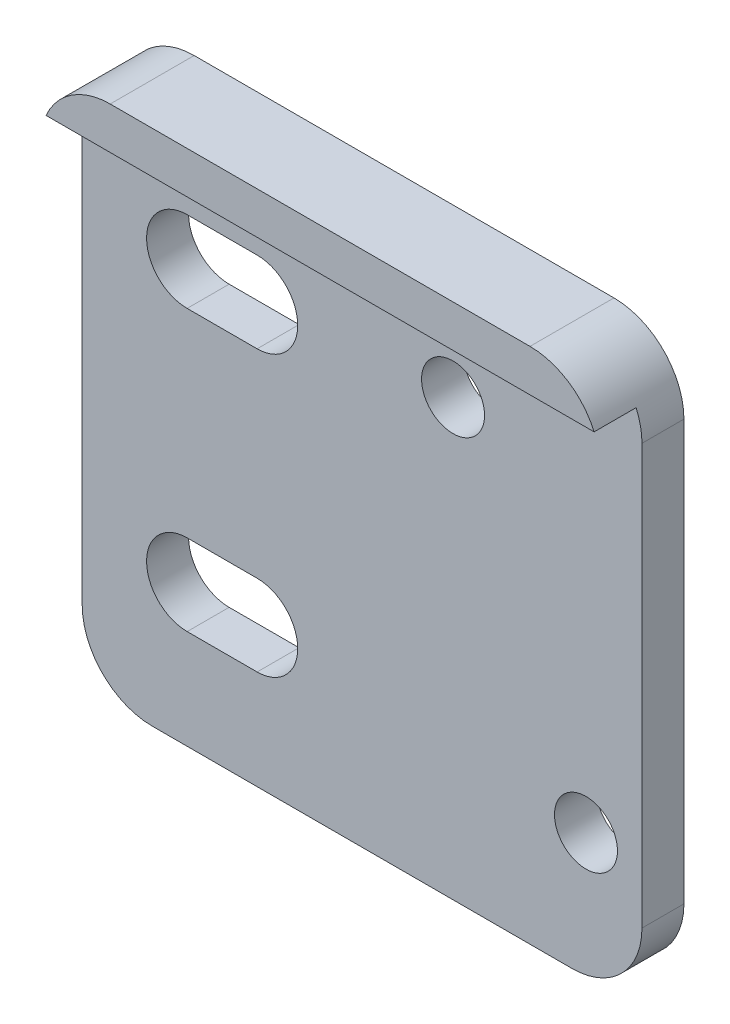
from build123d import *

# Parameters (mm, degrees)
SKETCH1_W                  = 40
SKETCH1_H                  = 40
BOSS_EXTRUDE1_DEPTH        = 3
F_4_5_4_5_DIAMETER_HOLE1_D = 4.5
M5_CLEARANCE_SLOT1_DEPTH   = 3
FILLET1_R                  = 5
BOSS_EXTRUDE2_START        = 3
BOSS_EXTRUDE2_DEPTH        = 3


# Read off the part's stored shape, not the designer's step: M5 Clearance Slot1
with BuildPart() as part:
    # Sketch1 → Boss-Extrude1 (new body)
    with BuildSketch(Plane.XY):
        with Locations((20, 20)):
            Rectangle(SKETCH1_W, SKETCH1_H)
    extrude(amount=BOSS_EXTRUDE1_DEPTH)

    # Ø4.5 (4.5) Diameter Hole1 (through all)
    with Locations(Plane.XY.offset(3)):
        with Locations((26.5, 31.1), (36, 8.9)):
            Hole(F_4_5_4_5_DIAMETER_HOLE1_D / 2)

    # M5 Clearance Slot1 outline → M5 Clearance Slot1 (cut)
    with BuildSketch(Plane.XY):
        with BuildLine():
            Line((7.5, 7.1), (12.5, 7.1))
            ThreePointArc((12.5, 7.1), (15.4, 10), (12.5, 12.9))
            Line((12.5, 12.9), (7.5, 12.9))
            ThreePointArc((7.5, 12.9), (4.6, 10), (7.5, 7.1))
        make_face()
        with BuildLine():
            Line((7.5, 27.1), (12.5, 27.1))
            ThreePointArc((12.5, 27.1), (15.4, 30), (12.5, 32.9))
            Line((12.5, 32.9), (7.5, 32.9))
            ThreePointArc((7.5, 32.9), (4.6, 30), (7.5, 27.1))
        make_face()
    extrude(amount=M5_CLEARANCE_SLOT1_DEPTH, mode=Mode.SUBTRACT)

    # Fillet1
    fillet1_edges = [part.edges().sort_by_distance(p)[0] for p in [
        (0, 40, 1.5),
        (40, 40, 1.5),
        (40, 0, 1.5),
        (0, 0, 1.5),
    ]]
    fillet(fillet1_edges, radius=FILLET1_R)

    # Sketch10 → Boss-Extrude2 (add)
    with BuildSketch(Plane.XY.offset(3).offset(BOSS_EXTRUDE2_START)):
        with BuildLine():
            Line((0.417424305, 37), (39.582575695, 37))
            ThreePointArc((39.582575695, 37), (37.738612788, 39.183300133), (35, 40))
            Line((35, 40), (5, 40))
            ThreePointArc((5, 40), (2.261387212, 39.183300133), (0.417424305, 37))
        make_face()
    extrude(amount=-BOSS_EXTRUDE2_DEPTH)


solid = part.part
